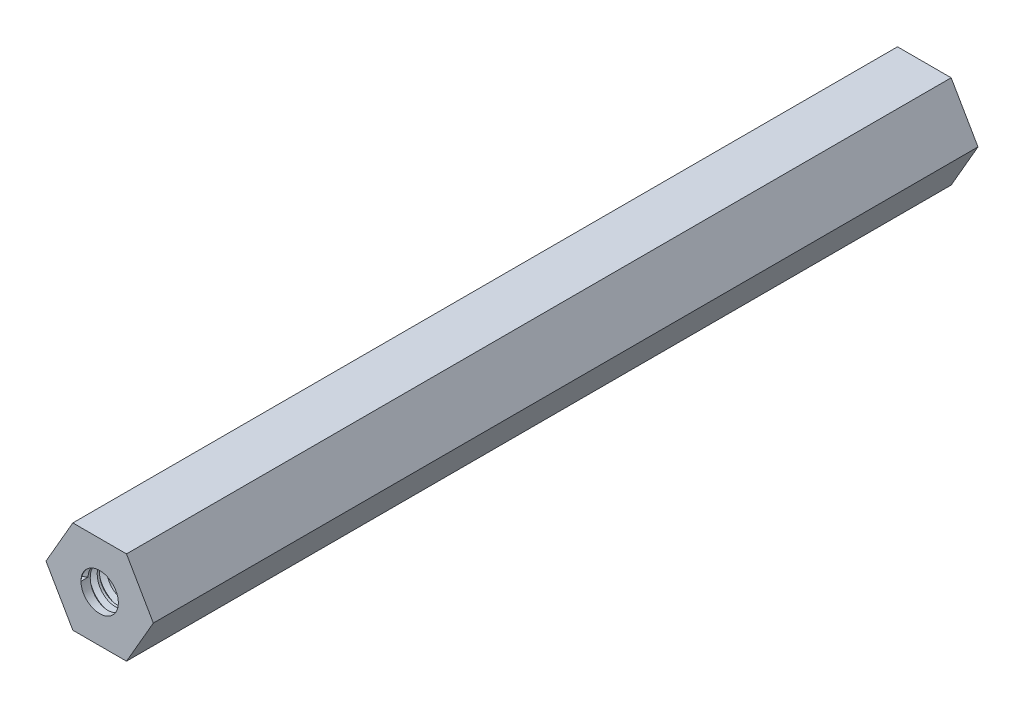
from build123d import *
from build123d.topology import SkipClean

# Parameters (mm, degrees)
EXTRUSI_N_HEX_PROFILE_DEPTH = 56.335499978
TAP_START                   = 56.3355
CROQUIS3_R                  = 2.5527
TAP_HOLE_1_DEPTH            = 19.05
TAP_START_2                 = -37.2855
CROQUIS3_3_R                = 2.5527
TAP_HOLE_2_DEPTH            = 19.05
ROSCA1_PITCH                = 1.27
ROSCA2_PITCH                = 1.27


with BuildPart() as part:
    # Croquis2 → Extrusión Hex Profile (new, symmetric)
    with BuildSketch(Plane.XY):
        Polygon((3.666174209, -6.35), (7.332348419, 0), (3.666174209, 6.35), (-3.666174209, 6.35), (-7.332348419, 0), (-3.666174209, -6.35), align=None)
    extrude(amount=EXTRUSI_N_HEX_PROFILE_DEPTH, both=True)

    # Croquis3 → Tap Hole 1 (cut)
    with BuildSketch(Plane.XY.offset(TAP_START)):
        Circle(CROQUIS3_R)
    extrude(amount=-TAP_HOLE_1_DEPTH, mode=Mode.SUBTRACT)

    # Croquis3<3> → Tap Hole 2 (cut)
    with BuildSketch(Plane.XY.offset(TAP_START_2)):
        Circle(CROQUIS3_3_R)
    extrude(amount=-TAP_HOLE_2_DEPTH, mode=Mode.SUBTRACT)

    # Rosca1: the profile of Perfil de rosca1 profile screwed along a right-hand helix of 15 turns, 8 arcs to a turn; built about Z, then put on its axis
    rosca1_z = Axis((0, 0, 0), (0, 0, 1))
    rosca1_corners = [(2.5524, 0, -0.000173205), (3.240107661, 0, 0.396874998), (3.240107661, 0, 0.555624998), (2.5524, 0, 0.952673202)]
    with BuildLine(mode=Mode.PRIVATE) as rosca1_profile:
        Line(rosca1_corners[0], rosca1_corners[1])
        Line(rosca1_corners[1], rosca1_corners[2])
        Line(rosca1_corners[2], rosca1_corners[3])
        Line(rosca1_corners[3], rosca1_corners[0])
    rosca1_cap = Face(rosca1_profile.wire())
    rosca1_turn_angles = [0, 22.5, 45, 67.5, 90, 112.5, 135, 157.5, 180, 202.5, 225, 247.5, 270, 292.5, 315, 337.5, 360]
    rosca1_turn_weights = [1, 0.9238795325112867, 1, 0.9238795325112867, 1, 0.9238795325112867, 1, 0.9238795325112867, 1, 0.9238795325112867, 1, 0.9238795325112867, 1, 0.9238795325112867, 1, 0.9238795325112867, 1]
    rosca1_turn_rails = [Edge.make_bspline([Vector(p[0], p[1], 0).rotate(rosca1_z, rosca1_turn_angles[k]) / rosca1_turn_weights[k] + Vector(0, 0, p[2] + ROSCA1_PITCH * rosca1_turn_angles[k] / 360) for k in range(17)], [0, 0, 0, 1, 1, 2, 2, 3, 3, 4, 4, 5, 5, 6, 6, 7, 7, 8, 8, 8], 2, rosca1_turn_weights) for p in rosca1_corners]
    rosca1_turn_sides = [Face.make_surface_from_curves(rosca1_turn_rails[p[0]], rosca1_turn_rails[p[1]]) for p in [(0, 1), (1, 2), (2, 3), (3, 0)]]
    rosca1 = Plane(origin=(0, 0, -56.335499978), x_dir=(1, 0, 0), z_dir=(0, 0, 1)) * Solid(Shell([*[p.moved(Location((0, 0, ROSCA1_PITCH * i))) for i in range(15) for p in rosca1_turn_sides], rosca1_cap, rosca1_cap.rotate(rosca1_z, 5400).moved(Location((0, 0, ROSCA1_PITCH * 5400 / 360)))]))
    add(rosca1, mode=Mode.SUBTRACT)

    # Rosca2: the profile of Perfil de rosca2 profile screwed along a right-hand helix of 15 turns, 8 arcs to a turn; built about Z, then put on its axis
    with SkipClean():  # the faces are left unmerged after this step: merging them gives an invalid solid
        rosca2_z = Axis((0, 0, 0), (0, 0, 1))
        rosca2_corners = [(2.5524, 0, -0.000173205), (3.240107661, 0, 0.396874998), (3.240107661, 0, 0.555624998), (2.5524, 0, 0.952673202)]
        with BuildLine(mode=Mode.PRIVATE) as rosca2_profile:
            Line(rosca2_corners[0], rosca2_corners[1])
            Line(rosca2_corners[1], rosca2_corners[2])
            Line(rosca2_corners[2], rosca2_corners[3])
            Line(rosca2_corners[3], rosca2_corners[0])
        rosca2_cap = Face(rosca2_profile.wire())
        rosca2_turn_angles = [0, 22.5, 45, 67.5, 90, 112.5, 135, 157.5, 180, 202.5, 225, 247.5, 270, 292.5, 315, 337.5, 360]
        rosca2_turn_weights = [1, 0.9238795325112867, 1, 0.9238795325112867, 1, 0.9238795325112867, 1, 0.9238795325112867, 1, 0.9238795325112867, 1, 0.9238795325112867, 1, 0.9238795325112867, 1, 0.9238795325112867, 1]
        rosca2_turn_rails = [Edge.make_bspline([Vector(p[0], p[1], 0).rotate(rosca2_z, rosca2_turn_angles[k]) / rosca2_turn_weights[k] + Vector(0, 0, p[2] + ROSCA2_PITCH * rosca2_turn_angles[k] / 360) for k in range(17)], [0, 0, 0, 1, 1, 2, 2, 3, 3, 4, 4, 5, 5, 6, 6, 7, 7, 8, 8, 8], 2, rosca2_turn_weights) for p in rosca2_corners]
        rosca2_turn_sides = [Face.make_surface_from_curves(rosca2_turn_rails[p[0]], rosca2_turn_rails[p[1]]) for p in [(0, 1), (1, 2), (2, 3), (3, 0)]]
        rosca2 = Plane(origin=(0, 0, 56.335499978), x_dir=(-1, 0, 0), z_dir=(0, 0, -1)) * Solid(Shell([*[p.moved(Location((0, 0, ROSCA2_PITCH * i))) for i in range(15) for p in rosca2_turn_sides], rosca2_cap, rosca2_cap.rotate(rosca2_z, 5400).moved(Location((0, 0, ROSCA2_PITCH * 5400 / 360)))]))
        add(rosca2, mode=Mode.SUBTRACT)


solid = part.part
